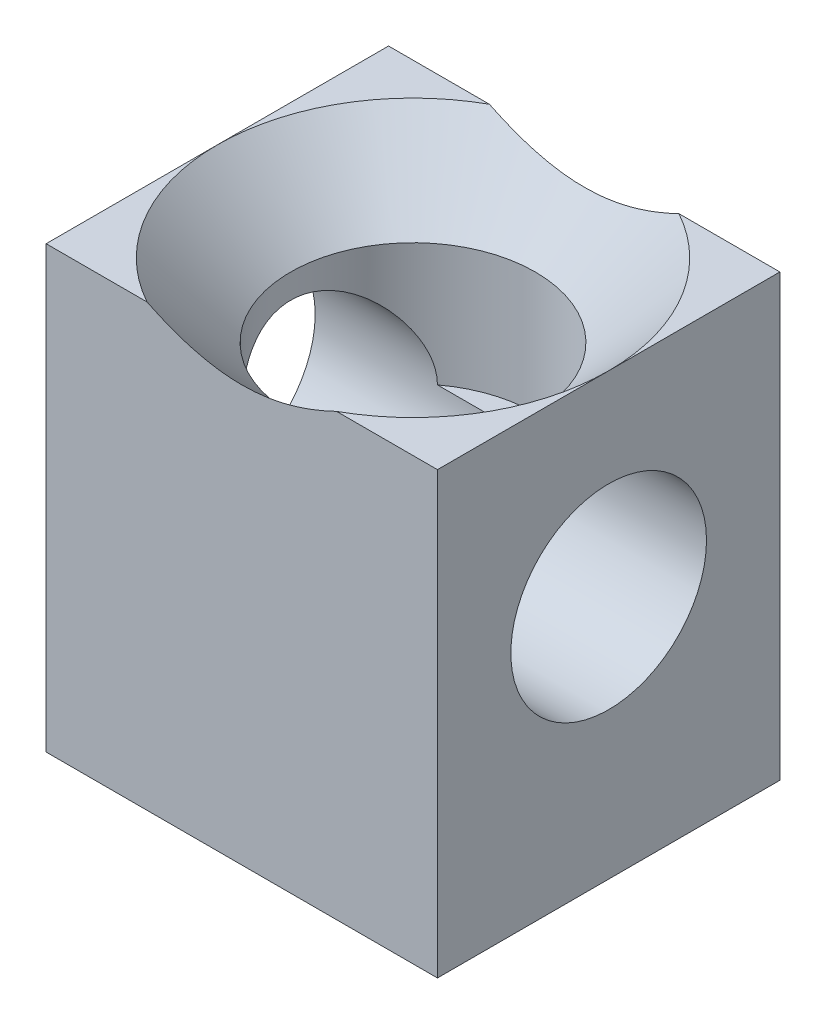
from build123d import *

# Parameters (mm, degrees)
TERMINALBODYS_W        = 4
TERMINALBODYS_H        = 3.5
TERMINAL_BODY_DEPTH    = 4.5
WIRE_ACCESS_DEPTH      = 6.22613624
WIRE_ACCESS_DEPTH_BACK = 6.22613624
WIREACCESSS_R          = 1


# Read off the part's stored shape, not the designer's step: M3x0.5 Tapped Hole1
with BuildPart() as part:
    # TerminalBodyS → TERMINAL BODY (new body)
    with BuildSketch(Plane(origin=(0, 0, 0), x_dir=(1, 0, 0), z_dir=(0, 1, 0))):
        Rectangle(TERMINALBODYS_W, TERMINALBODYS_H)
    extrude(amount=TERMINAL_BODY_DEPTH)

    # WireAccessS → WIRE ACCESS (cut, two sides: drawn at the far end of the back side and taken through both)
    with BuildSketch(Plane(origin=(0, 0, 0), x_dir=(0, 0, -1), z_dir=(1, 0, 0)).offset(-WIRE_ACCESS_DEPTH_BACK)):
        with Locations((0, 2.5)):
            Circle(WIREACCESSS_R)
    extrude(amount=WIRE_ACCESS_DEPTH + WIRE_ACCESS_DEPTH_BACK, mode=Mode.SUBTRACT)

    # M3x0.5 Tapped Hole1 outline → M3x0.5 Tapped Hole1 (revolve, cut)
    with BuildSketch(Plane.XY):
        Polygon((2, 4.5), (0, 4.5), (0, 2.5), (1.25, 2.5), (1.25, 3.75), align=None)
    revolve(axis=Axis((0, 0, 0), (0, 1, 0)), mode=Mode.SUBTRACT)


solid = part.part
